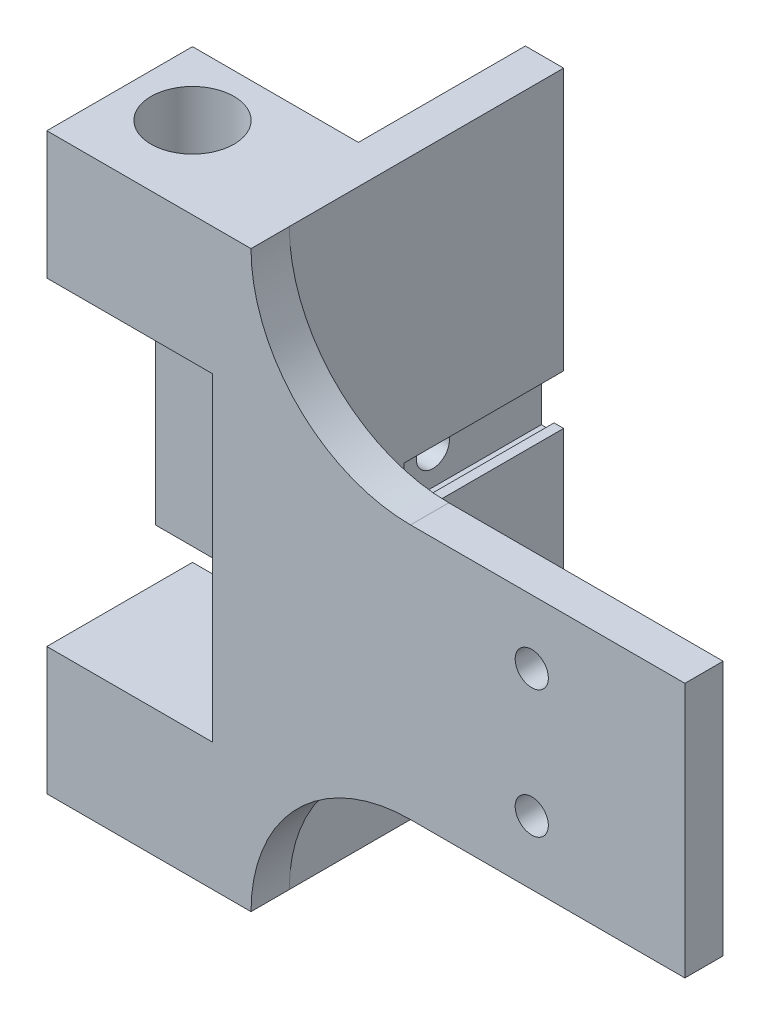
from build123d import *

# Parameters (mm, degrees)
SKETCH1_W               = 74
SKETCH1_H               = 90
SKETCH1_R               = 2.6
BOSS_EXTRUDE1_DEPTH     = 6
SKETCH2_W               = 6
SKETCH2_H               = 90
BOSS_EXTRUDE2_DEPTH     = 43
SKETCH4_W               = 68
SKETCH4_H               = 25
CUT_EXTRUDE3_DEPTH      = 6
FILLET2_R               = 25
SKETCH5_W               = 34
SKETCH5_H               = 30
BOSS_EXTRUDE3_DEPTH     = 24
CUT_EXTRUDE1_DEPTH      = 125.197423484
CUT_EXTRUDE1_DEPTH_BACK = 125.197423484
SKETCH3_R               = 2.6
SKETCH6_W               = 17.25
SKETCH6_H               = 28
CUT_EXTRUDE4_DEPTH      = 105.522724802
CUT_EXTRUDE5_DEPTH      = 25
SKETCH8_W               = 22.83
SKETCH8_H               = 20
BOSS_EXTRUDE4_DEPTH     = 26
SKETCH9_R               = 6.5
CUT_EXTRUDE6_DEPTH      = 10
CUT_EXTRUDE7_START      = -10
SKETCH10_R              = 6.5
CUT_EXTRUDE7_DEPTH      = 10


with BuildPart() as part:
    # Sketch1 → Boss-Extrude1 (new body)
    with BuildSketch(Plane.XY):
        with Locations((37, 45)):
            Rectangle(SKETCH1_W, SKETCH1_H)
        with Locations((50, 55)):
            Circle(SKETCH1_R, mode=Mode.SUBTRACT)
        with Locations((50, 35)):
            Circle(SKETCH1_R, mode=Mode.SUBTRACT)
    extrude(amount=BOSS_EXTRUDE1_DEPTH)

    # Sketch2 → Boss-Extrude2 (add)
    with BuildSketch(Plane(origin=(0, 0, 0), x_dir=(-1, 0, 0), z_dir=(0, 0, -1))):
        with Locations((-3, 45)):
            Rectangle(SKETCH2_W, SKETCH2_H)
    extrude(amount=BOSS_EXTRUDE2_DEPTH)

    # Sketch4 → Cut-Extrude3 (cut)
    with BuildSketch(Plane(origin=(0, 0, 0), x_dir=(-1, 0, 0), z_dir=(0, 0, -1))):
        with Locations((-40, 77.5)):
            Rectangle(SKETCH4_W, SKETCH4_H)
        with Locations((-40, 12.5)):
            Rectangle(SKETCH4_W, SKETCH4_H)
    extrude(amount=-CUT_EXTRUDE3_DEPTH, mode=Mode.SUBTRACT)

    # Fillet2
    fillet2_edges = [part.edges().sort_by_distance(p)[0] for p in [
        (6, 65, 3),
        (6, 25, 3),
    ]]
    fillet(fillet2_edges, radius=FILLET2_R - 0.0001)  # a hair under: the kernel refuses the full size

    # Sketch5 → Boss-Extrude3 (add)
    with BuildSketch(Plane.ZY):
        with Locations((-26, 45)):
            Rectangle(SKETCH5_W, SKETCH5_H)
    extrude(amount=BOSS_EXTRUDE3_DEPTH)

    # Sketch3 → Cut-Extrude1 (cut, two sides: drawn at the far end of the back side and taken through both)
    with BuildSketch(Plane.ZY.offset(-CUT_EXTRUDE1_DEPTH_BACK)):
        with Locations((-26, 45)):
            Circle(SKETCH3_R)
    extrude(amount=CUT_EXTRUDE1_DEPTH + CUT_EXTRUDE1_DEPTH_BACK, mode=Mode.SUBTRACT)

    # Sketch6 → Cut-Extrude4 (cut, through all)
    with BuildSketch(Plane(origin=(0, 60, 0), x_dir=(1, 0, 0), z_dir=(0, 1, 0))):
        with Locations((-12.375, 26)):
            Rectangle(SKETCH6_W, SKETCH6_H)
    extrude(amount=-CUT_EXTRUDE4_DEPTH, mode=Mode.SUBTRACT)

    # Sketch7 → Cut-Extrude5 (cut)
    with BuildSketch(Plane(origin=(0, 0, -43), x_dir=(-1, 0, 0), z_dir=(0, 0, -1))):
        Polygon((-2.5, 50.15), (-4.5, 50.15), (-4.5, 48.9), (-7.5, 48.9), (-7.5, 41.1), (-4.5, 41.1), (-4.5, 39.85), (-2.5, 39.85), align=None)
    extrude(amount=-CUT_EXTRUDE5_DEPTH, mode=Mode.SUBTRACT)

    # Sketch8 → Boss-Extrude4 (add)
    with BuildSketch(Plane.ZY):
        with Locations((-5.415, 10)):
            Rectangle(SKETCH8_W, SKETCH8_H)
        with Locations((-5.415, 80)):
            Rectangle(SKETCH8_W, SKETCH8_H)
    extrude(amount=BOSS_EXTRUDE4_DEPTH)

    # Sketch9 → Cut-Extrude6 (cut)
    with BuildSketch(Plane.XZ):
        with Locations(Location((-16, -6.83, 0), (0, 0, 270))):
            Circle(SKETCH9_R)
    extrude(amount=-CUT_EXTRUDE6_DEPTH, mode=Mode.SUBTRACT)

    # Sketch10 → Cut-Extrude7 (cut)
    with BuildSketch(Plane(origin=(0, 90, 0), x_dir=(1, 0, 0), z_dir=(0, 1, 0)).offset(CUT_EXTRUDE7_START)):
        with Locations(Location((-16, 6.83, 0), (0, 0, 90))):
            Circle(SKETCH10_R)
    extrude(amount=CUT_EXTRUDE7_DEPTH, mode=Mode.SUBTRACT)


solid = part.part
